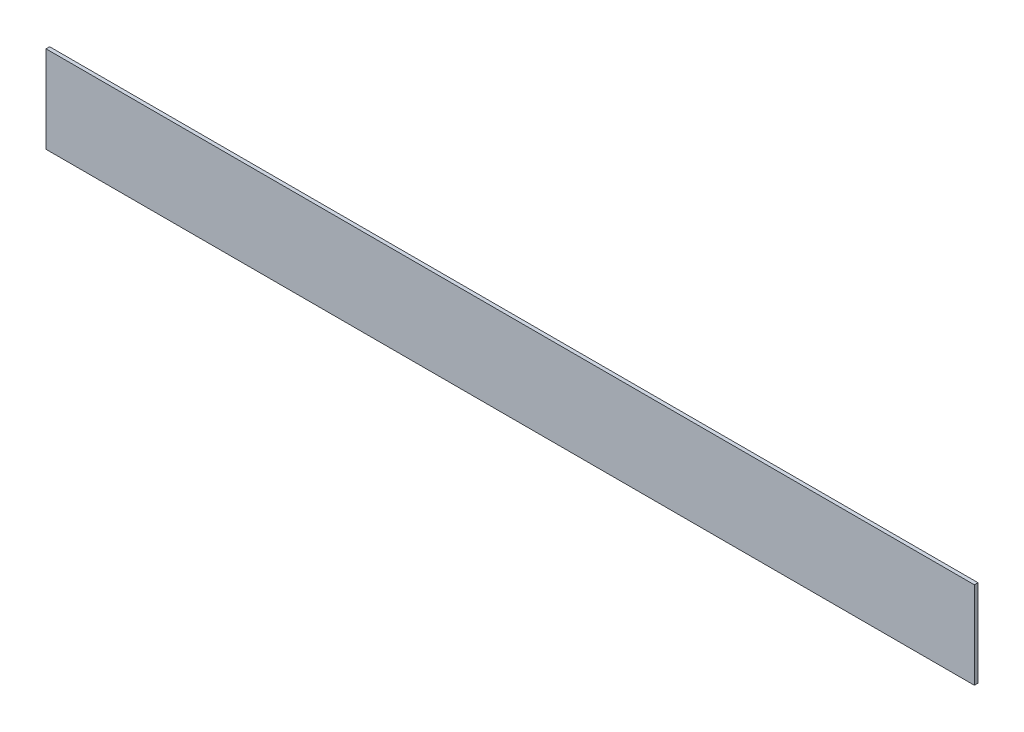
from build123d import *

# Parameters (mm, degrees)
SKETCH1_W           = 406.4
SKETCH1_H           = 1.5875
BOSS_EXTRUDE1_DEPTH = 38.1


with BuildPart() as part:
    # Sketch1 → Boss-Extrude1 (new body)
    with BuildSketch(Plane(origin=(0, 0, 0), x_dir=(1, 0, 0), z_dir=(0, 1, 0))):
        with Locations((203.2, 0.79375)):
            Rectangle(SKETCH1_W, SKETCH1_H)
    extrude(amount=BOSS_EXTRUDE1_DEPTH)


solid = part.part
